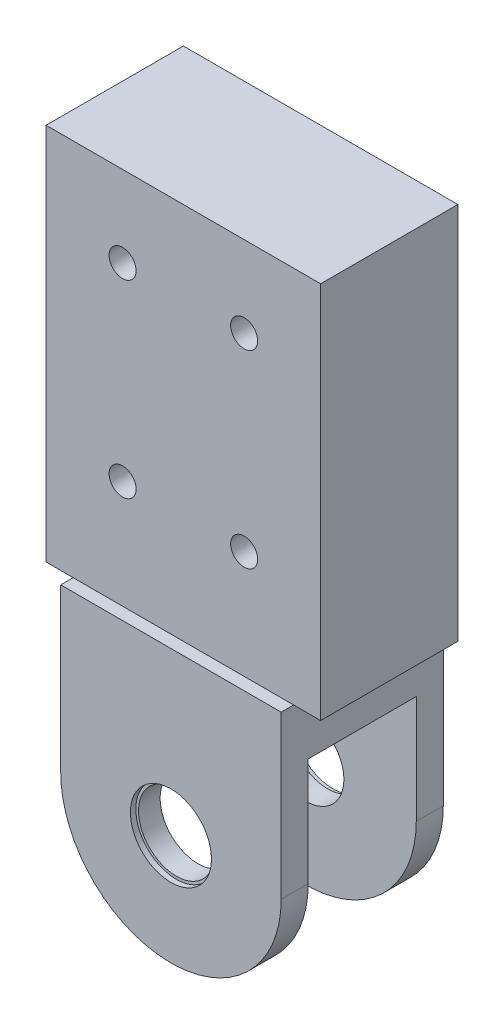
from build123d import *

# Parameters (mm, degrees)
SKETCH1_R           = 7
SKETCH1_R_2         = 2.5
BOSS_EXTRUDE1_DEPTH = 30
SKETCH2_W           = 20
SKETCH2_H           = 45.4
CUT_EXTRUDE1_DEPTH  = 117.106158321
SKETCH3_R           = 7.5
CUT_EXTRUDE2_DEPTH  = 1
CUT_EXTRUDE3_START  = -1
SKETCH4_R           = 7.5
CUT_EXTRUDE3_DEPTH  = 1
SKETCH5_W           = 2.3
SKETCH5_H           = 70
CUT_EXTRUDE4_DEPTH  = 117.106158321
CUT_EXTRUDE5_DEPTH  = 108.448406224


with BuildPart() as part:
    # Sketch1 → Boss-Extrude1 (new body)
    with BuildSketch(Plane.XY):
        with BuildLine():
            Line((-25.4, 0), (-25.4, 100))
            Line((-25.4, 100), (25.4, 100))
            Line((25.4, 100), (25.4, 0))
            ThreePointArc((25.4, 0), (0, -25.4), (-25.4, 0))
        make_face()
        Circle(SKETCH1_R, mode=Mode.SUBTRACT)
        with Locations((-11.25, 85)):
            Circle(SKETCH1_R_2, mode=Mode.SUBTRACT)
        with Locations((11.25, 85)):
            Circle(SKETCH1_R_2, mode=Mode.SUBTRACT)
        with Locations((11.25, 50)):
            Circle(SKETCH1_R_2, mode=Mode.SUBTRACT)
        with Locations((-11.25, 50)):
            Circle(SKETCH1_R_2, mode=Mode.SUBTRACT)
    extrude(amount=BOSS_EXTRUDE1_DEPTH)

    # Sketch2 → Cut-Extrude1 (cut, through all)
    with BuildSketch(Plane(origin=(25.4, 0, 0), x_dir=(0, 0, -1), z_dir=(1, 0, 0))):
        with Locations((-15, -2.7)):
            Rectangle(SKETCH2_W, SKETCH2_H)
    extrude(amount=-CUT_EXTRUDE1_DEPTH, mode=Mode.SUBTRACT)

    # Sketch3 → Cut-Extrude2 (cut)
    with BuildSketch(Plane.XY.offset(30)):
        Circle(SKETCH3_R)
    extrude(amount=-CUT_EXTRUDE2_DEPTH, mode=Mode.SUBTRACT)

    # Sketch4 → Cut-Extrude3 (cut)
    with BuildSketch(Plane(origin=(0, 0, 0), x_dir=(-1, 0, 0), z_dir=(0, 0, -1)).offset(CUT_EXTRUDE3_START)):
        Circle(SKETCH4_R)
    extrude(amount=CUT_EXTRUDE3_DEPTH, mode=Mode.SUBTRACT)

    # Sketch5 → Cut-Extrude4 (cut, through all)
    with BuildSketch(Plane(origin=(25.4, 0, 0), x_dir=(0, 0, -1), z_dir=(1, 0, 0))):
        with Locations((-28.85, 65)):
            Rectangle(SKETCH5_W, SKETCH5_H)
        with Locations((-1.15, 65)):
            Rectangle(SKETCH5_W, SKETCH5_H)
    extrude(amount=-CUT_EXTRUDE4_DEPTH, mode=Mode.SUBTRACT)

    # Sketch6 → Cut-Extrude5 (cut, through all)
    with BuildSketch(Plane.XY.offset(30)):
        with BuildLine():
            Line((-20.4, 0), (-20.4, 30))
            Line((-20.4, 30), (-25.4, 30))
            Line((-25.4, 30), (-25.4, -25.4))
            Line((-25.4, -25.4), (25.4, -25.4))
            Line((25.4, -25.4), (25.4, 30))
            Line((25.4, 30), (20.4, 30))
            Line((20.4, 30), (20.4, 0))
            ThreePointArc((20.4, 0), (0, -20.4), (-20.4, 0))
        make_face()
    extrude(amount=-CUT_EXTRUDE5_DEPTH, mode=Mode.SUBTRACT)


solid = part.part
